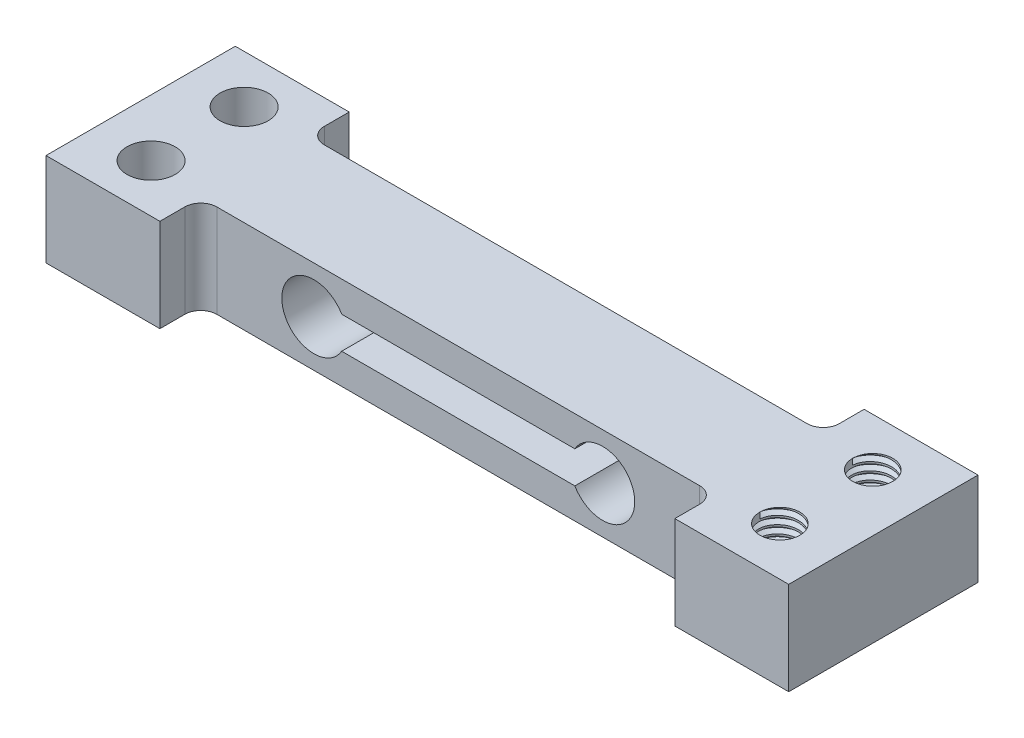
from build123d import *

# Parameters (mm, degrees)
SKETCH1_W             = 32.1
SKETCH1_H             = 6.7
BOSS_EXTRUDE1_DEPTH   = 5.8
FILLET1_R             = 1
CUT_EXTRUDE1_DEPTH    = 26.595409745
SKETCH3_R             = 1.5
CUT_EXTRUDE2_DEPTH    = 25.583988692
M3X0_5_TAPPED_HOLE1_D = 2.5
THREAD1_PITCH         = 0.5
THREAD2_PITCH         = 0.5


with BuildPart() as part:
    # Sketch1 → Boss-Extrude1 (new body)
    with BuildSketch(Plane(origin=(0, 0, 0), x_dir=(1, 0, 0), z_dir=(0, 1, 0))):
        Polygon((-16.05, -5.9), (-16.05, -3.35), (-16.05, 3.35), (-16.05, 5.9), (-23.15, 5.9), (-23.15, -5.9), align=None)
        Rectangle(SKETCH1_W, SKETCH1_H)
        Polygon((16.05, 3.35), (16.05, -3.35), (16.05, -5.9), (23.15, -5.9), (23.15, 5.9), (16.05, 5.9), align=None)
    extrude(amount=BOSS_EXTRUDE1_DEPTH)

    # Fillet1
    fillet1_edges = [part.edges().sort_by_distance(p)[0] for p in [
        (-16.05, 2.9, -3.35),
        (16.05, 2.9, -3.35),
        (16.05, 2.9, 3.35),
        (-16.05, 2.9, 3.35),
    ]]
    fillet(fillet1_edges, radius=FILLET1_R)

    # Sketch2 → Cut-Extrude1 (cut, through all)
    with BuildSketch(Plane(origin=(0, 0, -3.35), x_dir=(-1, 0, 0), z_dir=(0, 0, -1))):
        with BuildLine():
            Line((7.267949192, 3.9), (-7.267949192, 3.9))
            ThreePointArc((-7.267949192, 3.9), (-7.068148347, 3.41763809), (-7, 2.9))
            ThreePointArc((-7, 2.9), (-7.068148347, 2.38236191), (-7.267949192, 1.9))
            Line((-7.267949192, 1.9), (7.267949192, 1.9))
            ThreePointArc((7.267949192, 1.9), (7, 2.9), (7.267949192, 3.9))
        make_face()
        with BuildLine():
            ThreePointArc((11, 2.9), (9.51763809, 4.831851653), (7.267949192, 3.9))
            Line((7.267949192, 3.9), (7.5, 3.9))
            Line((7.5, 3.9), (7.5, 1.9))
            Line((7.5, 1.9), (7.267949192, 1.9))
            ThreePointArc((7.267949192, 1.9), (9.51763809, 0.968148347), (11, 2.9))
        make_face()
        with BuildLine():
            Line((7.5, 3.9), (7.267949192, 3.9))
            ThreePointArc((7.267949192, 3.9), (7, 2.9), (7.267949192, 1.9))
            Line((7.267949192, 1.9), (7.5, 1.9))
            Line((7.5, 1.9), (7.5, 3.9))
        make_face()
        with BuildLine():
            Line((-7.5, 1.9), (-7.5, 3.9))
            Line((-7.5, 3.9), (-7.267949192, 3.9))
            ThreePointArc((-7.267949192, 3.9), (-11, 2.9), (-7.267949192, 1.9))
            Line((-7.267949192, 1.9), (-7.5, 1.9))
        make_face()
        with BuildLine():
            Line((-7.267949192, 3.9), (-7.5, 3.9))
            Line((-7.5, 3.9), (-7.5, 1.9))
            Line((-7.5, 1.9), (-7.267949192, 1.9))
            ThreePointArc((-7.267949192, 1.9), (-7.068148347, 2.38236191), (-7, 2.9))
            ThreePointArc((-7, 2.9), (-7.068148347, 3.41763809), (-7.267949192, 3.9))
        make_face()
    extrude(amount=-CUT_EXTRUDE1_DEPTH, mode=Mode.SUBTRACT)

    # Sketch3 → Cut-Extrude2 (cut, through all)
    with BuildSketch(Plane(origin=(0, 5.8, 0), x_dir=(1, 0, 0), z_dir=(0, 1, 0))):
        with Locations(Location((-19.6, 2.9, 0), (0, 0, 270))):
            Circle(SKETCH3_R)
        with Locations(Location((-19.6, -2.9, 0), (0, 0, 270))):
            Circle(SKETCH3_R)
    extrude(amount=-CUT_EXTRUDE2_DEPTH, mode=Mode.SUBTRACT)

    # M3x0.5 Tapped Hole1 (through all)
    with Locations(Plane(origin=(0, 5.8, 0), x_dir=(1, 0, 0), z_dir=(0, 1, 0))):
        with Locations((19.58906744, 2.9), (19.6, -2.9)):
            Hole(M3X0_5_TAPPED_HOLE1_D / 2)

    # Thread1: the profile of Thread Profile1 profile screwed along a right-hand helix of 20 turns, 6 arcs to a turn; built about Z, then put on its axis
    thread1_z = Axis((0, 0, 0), (0, 0, 1))
    thread1_corners = [(1.2497, 0, -0.000173205), (1.520632938, 0, 0.156249999), (1.520632938, 0, 0.218749999), (1.2497, 0, 0.375173204)]
    with BuildLine(mode=Mode.PRIVATE) as thread1_profile:
        Line(thread1_corners[0], thread1_corners[1])
        Line(thread1_corners[1], thread1_corners[2])
        Line(thread1_corners[2], thread1_corners[3])
        Line(thread1_corners[3], thread1_corners[0])
    thread1_cap = Face(thread1_profile.wire())
    thread1_turn_angles = [0, 30, 60, 90, 120, 150, 180, 210, 240, 270, 300, 330, 360]
    thread1_turn_weights = [1, 0.8660254037844387, 1, 0.8660254037844387, 1, 0.8660254037844387, 1, 0.8660254037844387, 1, 0.8660254037844387, 1, 0.8660254037844387, 1]
    thread1_turn_rails = [Edge.make_bspline([Vector(p[0], p[1], 0).rotate(thread1_z, thread1_turn_angles[k]) / thread1_turn_weights[k] + Vector(0, 0, p[2] + THREAD1_PITCH * thread1_turn_angles[k] / 360) for k in range(13)], [0, 0, 0, 1, 1, 2, 2, 3, 3, 4, 4, 5, 5, 6, 6, 6], 2, thread1_turn_weights) for p in thread1_corners]
    thread1_turn_sides = [Face.make_surface_from_curves(thread1_turn_rails[p[0]], thread1_turn_rails[p[1]]) for p in [(0, 1), (1, 2), (2, 3), (3, 0)]]
    thread1 = Plane(origin=(19.58906744, 5.8, -2.9), x_dir=(-1, 0, 0), z_dir=(0, -1, 0)) * Solid(Shell([*[p.moved(Location((0, 0, THREAD1_PITCH * i))) for i in range(20) for p in thread1_turn_sides], thread1_cap, thread1_cap.rotate(thread1_z, 7200).moved(Location((0, 0, THREAD1_PITCH * 7200 / 360)))]))
    add(thread1, mode=Mode.SUBTRACT)

    # Thread2: the profile of Thread Profile2 profile screwed along a right-hand helix of 20 turns, 6 arcs to a turn; built about Z, then put on its axis
    thread2_z = Axis((0, 0, 0), (0, 0, 1))
    thread2_corners = [(1.2497, 0, -0.000173205), (1.520632937, 0, 0.156249999), (1.520632937, 0, 0.218749999), (1.2497, 0, 0.375173204)]
    with BuildLine(mode=Mode.PRIVATE) as thread2_profile:
        Line(thread2_corners[0], thread2_corners[1])
        Line(thread2_corners[1], thread2_corners[2])
        Line(thread2_corners[2], thread2_corners[3])
        Line(thread2_corners[3], thread2_corners[0])
    thread2_cap = Face(thread2_profile.wire())
    thread2_turn_angles = [0, 30, 60, 90, 120, 150, 180, 210, 240, 270, 300, 330, 360]
    thread2_turn_weights = [1, 0.8660254037844387, 1, 0.8660254037844387, 1, 0.8660254037844387, 1, 0.8660254037844387, 1, 0.8660254037844387, 1, 0.8660254037844387, 1]
    thread2_turn_rails = [Edge.make_bspline([Vector(p[0], p[1], 0).rotate(thread2_z, thread2_turn_angles[k]) / thread2_turn_weights[k] + Vector(0, 0, p[2] + THREAD2_PITCH * thread2_turn_angles[k] / 360) for k in range(13)], [0, 0, 0, 1, 1, 2, 2, 3, 3, 4, 4, 5, 5, 6, 6, 6], 2, thread2_turn_weights) for p in thread2_corners]
    thread2_turn_sides = [Face.make_surface_from_curves(thread2_turn_rails[p[0]], thread2_turn_rails[p[1]]) for p in [(0, 1), (1, 2), (2, 3), (3, 0)]]
    thread2 = Plane(origin=(19.6, 5.8, 2.9), x_dir=(-1, 0, 0), z_dir=(0, -1, 0)) * Solid(Shell([*[p.moved(Location((0, 0, THREAD2_PITCH * i))) for i in range(20) for p in thread2_turn_sides], thread2_cap, thread2_cap.rotate(thread2_z, 7200).moved(Location((0, 0, THREAD2_PITCH * 7200 / 360)))]))
    add(thread2, mode=Mode.SUBTRACT)


solid = part.part
